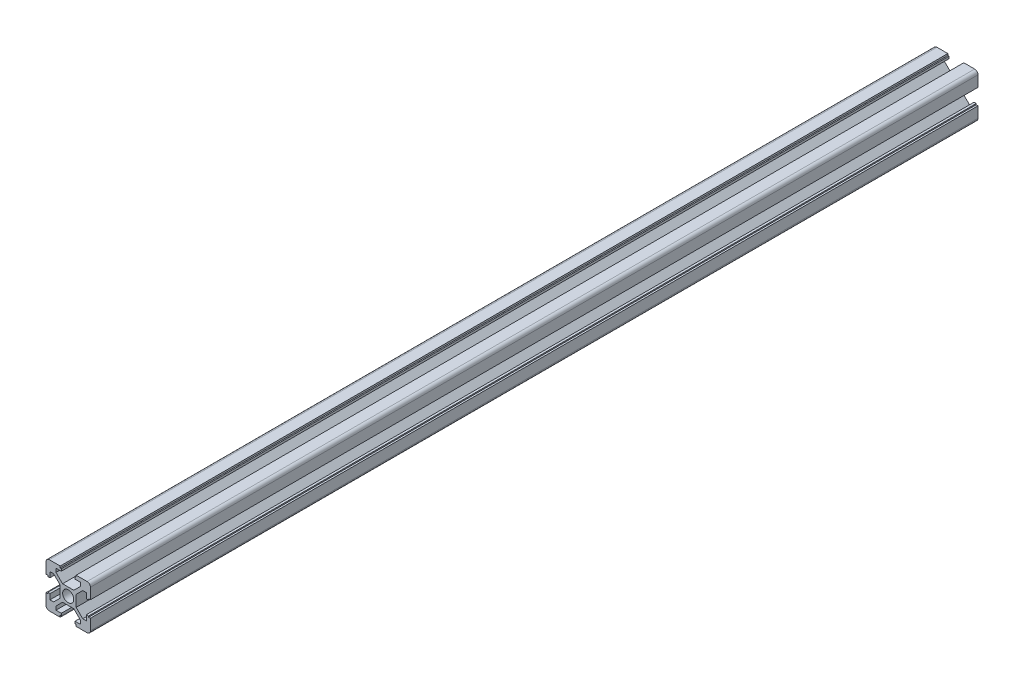
from build123d import *

# Parameters (mm, degrees)
SKETCH_1_R          = 2.5
EXTRUDE_1_DEPTH     = 400
SKETCH_2_R          = 1.75
CUT_EXTRUDE_2_DEPTH = 21


with BuildPart() as part:
    # 草图1 → 凸台-拉伸1 (new body)
    with BuildSketch(Plane.XY):
        with BuildLine():
            Line((-7.376269156, 6.834632883), (-4.415608984, 3.873972711))
            Line((-4.415608984, 3.873972711), (-4.415608984, -1.204706946))
            Line((-4.415608984, -1.204706946), (-7.376269156, -4.165367117))
            Line((-7.376269156, -4.165367117), (-9.015608984, -4.165367117))
            Line((-9.015608984, -4.165367117), (-9.015608984, -1.765367117))
            Line((-9.015608984, -1.765367117), (-10.015608984, -1.765367117))
            Line((-10.015608984, -1.765367117), (-10.015608984, -2.265367117))
            Line((-10.015608984, -2.265367117), (-10.815608984, -2.265367117))
            Line((-10.815608984, -2.265367117), (-10.815608984, -7.165367117))
            ThreePointArc((-10.815608984, -7.165367117), (-10.376269156, -8.226027289), (-9.315608984, -8.665367117))
            Line((-9.315608984, -8.665367117), (-4.415608984, -8.665367117))
            Line((-4.415608984, -8.665367117), (-4.415608984, -7.865367117))
            Line((-4.415608984, -7.865367117), (-3.915608984, -7.865367117))
            Line((-3.915608984, -7.865367117), (-3.915608984, -6.865367117))
            Line((-3.915608984, -6.865367117), (-6.315608984, -6.865367117))
            Line((-6.315608984, -6.865367117), (-6.315608984, -5.226027289))
            Line((-6.315608984, -5.226027289), (-3.354948812, -2.265367117))
            Line((-3.354948812, -2.265367117), (1.723730844, -2.265367117))
            Line((1.723730844, -2.265367117), (4.684391016, -5.226027289))
            Line((4.684391016, -5.226027289), (4.684391016, -6.865367117))
            Line((4.684391016, -6.865367117), (2.284391016, -6.865367117))
            Line((2.284391016, -6.865367117), (2.284391016, -7.865367117))
            Line((2.284391016, -7.865367117), (2.784391016, -7.865367117))
            Line((2.784391016, -7.865367117), (2.784391016, -8.665367117))
            Line((2.784391016, -8.665367117), (7.684391016, -8.665367117))
            ThreePointArc((7.684391016, -8.665367117), (8.745051188, -8.226027289), (9.184391016, -7.165367117))
            Line((9.184391016, -7.165367117), (9.184391016, -2.265367117))
            Line((9.184391016, -2.265367117), (8.384391016, -2.265367117))
            Line((8.384391016, -2.265367117), (8.384391016, -1.765367117))
            Line((8.384391016, -1.765367117), (7.384391016, -1.765367117))
            Line((7.384391016, -1.765367117), (7.384391016, -4.165367117))
            Line((7.384391016, -4.165367117), (5.745051188, -4.165367117))
            Line((5.745051188, -4.165367117), (2.784391016, -1.204706946))
            Line((2.784391016, -1.204706946), (2.784391016, 3.873972711))
            Line((2.784391016, 3.873972711), (5.745051188, 6.834632883))
            Line((5.745051188, 6.834632883), (7.384391016, 6.834632883))
            Line((7.384391016, 6.834632883), (7.384391016, 4.434632883))
            Line((7.384391016, 4.434632883), (8.384391016, 4.434632883))
            Line((8.384391016, 4.434632883), (8.384391016, 4.934632883))
            Line((8.384391016, 4.934632883), (9.184391016, 4.934632883))
            Line((9.184391016, 4.934632883), (9.184391016, 9.834632883))
            ThreePointArc((9.184391016, 9.834632883), (8.745051188, 10.895293054), (7.684391016, 11.334632883))
            Line((7.684391016, 11.334632883), (2.784391016, 11.334632883))
            Line((2.784391016, 11.334632883), (2.784391016, 10.534632883))
            Line((2.784391016, 10.534632883), (2.284391016, 10.534632883))
            Line((2.284391016, 10.534632883), (2.284391016, 9.534632883))
            Line((2.284391016, 9.534632883), (4.684391016, 9.534632883))
            Line((4.684391016, 9.534632883), (4.684391016, 7.895293054))
            Line((4.684391016, 7.895293054), (1.723730844, 4.934632883))
            Line((1.723730844, 4.934632883), (-3.354948812, 4.934632883))
            Line((-3.354948812, 4.934632883), (-6.315608984, 7.895293054))
            Line((-6.315608984, 7.895293054), (-6.315608984, 9.534632883))
            Line((-6.315608984, 9.534632883), (-3.915608984, 9.534632883))
            Line((-3.915608984, 9.534632883), (-3.915608984, 10.534632883))
            Line((-3.915608984, 10.534632883), (-4.415608984, 10.534632883))
            Line((-4.415608984, 10.534632883), (-4.415608984, 11.334632883))
            Line((-4.415608984, 11.334632883), (-9.315608984, 11.334632883))
            ThreePointArc((-9.315608984, 11.334632883), (-10.376269156, 10.895293054), (-10.815608984, 9.834632883))
            Line((-10.815608984, 9.834632883), (-10.815608984, 4.934632883))
            Line((-10.815608984, 4.934632883), (-10.015608984, 4.934632883))
            Line((-10.015608984, 4.934632883), (-10.015608984, 4.434632883))
            Line((-10.015608984, 4.434632883), (-9.015608984, 4.434632883))
            Line((-9.015608984, 4.434632883), (-9.015608984, 6.834632883))
            Line((-9.015608984, 6.834632883), (-7.376269156, 6.834632883))
        make_face()
        with Locations((-0.815608984, 1.334632883)):
            Circle(SKETCH_1_R, mode=Mode.SUBTRACT)
    extrude(amount=EXTRUDE_1_DEPTH)

    # 草图2 → 切除-拉伸2 (cut)
    with BuildSketch(Plane.ZY.offset(4.415608984)):
        with Locations((320, 1.334632883)):
            Circle(SKETCH_2_R)
        with Locations((80, 1.334632883)):
            Circle(SKETCH_2_R)
    extrude(amount=-CUT_EXTRUDE_2_DEPTH, mode=Mode.SUBTRACT)


solid = part.part
